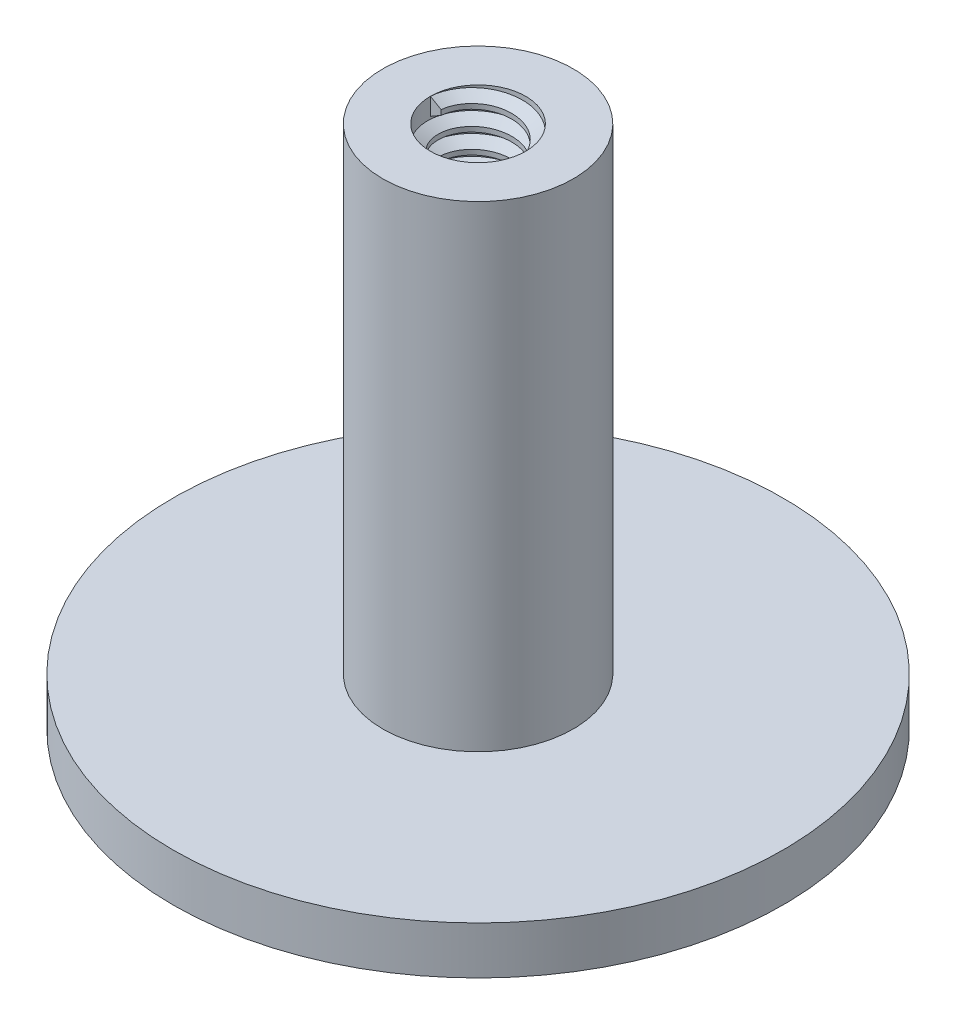
from build123d import *
from build123d.topology import SkipClean

# Parameters (mm, degrees)
SKETCH1_R           = 16.256
BOSS_EXTRUDE2_DEPTH = 2.54
SKETCH3_R           = 5.08
BOSS_EXTRUDE4_DEPTH = 25.4
SKETCH4_R           = 2.54
CUT_EXTRUDE1_DEPTH  = 24.13
THREAD1_PITCH       = 1.058333333


with BuildPart() as part:
    # Sketch1 → Boss-Extrude2 (new body)
    with BuildSketch(Plane(origin=(0, 0, 0), x_dir=(1, 0, 0), z_dir=(0, 1, 0))):
        with Locations(Location((0, 0, 0), (0, 0, 270))):
            Circle(SKETCH1_R)
    extrude(amount=BOSS_EXTRUDE2_DEPTH)

    # Sketch3 → Boss-Extrude4 (add)
    with BuildSketch(Plane(origin=(0, 2.54, 0), x_dir=(1, 0, 0), z_dir=(0, 1, 0))):
        with Locations(Location((0, 0, 0), (0, 0, 270))):
            Circle(SKETCH3_R)
    extrude(amount=BOSS_EXTRUDE4_DEPTH)

    # Sketch4 → Cut-Extrude1 (cut)
    with BuildSketch(Plane(origin=(0, 27.94, 0), x_dir=(1, 0, 0), z_dir=(0, 1, 0))):
        with Locations(Location((0, 0, 0), (0, 0, 270))):
            Circle(SKETCH4_R)
    extrude(amount=-CUT_EXTRUDE1_DEPTH, mode=Mode.SUBTRACT)

    # Thread1: the profile of Thread Profile1 profile screwed along a right-hand helix of 19.2 turns, 8 arcs to a turn; built about Z, then put on its axis
    with SkipClean():  # the faces are left unmerged after this step: merging them gives an invalid solid
        thread1_z = Axis((0, 0, 0), (0, 0, 1))
        thread1_corners = [(2.5403, 0, -0.000173205), (2.5403, 0, 0.926214869), (1.967160282, 0, 0.595312499), (1.967160282, 0, 0.330729165)]
        with BuildLine(mode=Mode.PRIVATE) as thread1_profile:
            Line(thread1_corners[0], thread1_corners[1])
            Line(thread1_corners[1], thread1_corners[2])
            Line(thread1_corners[2], thread1_corners[3])
            Line(thread1_corners[3], thread1_corners[0])
        thread1_cap = Face(thread1_profile.wire())
        thread1_turn_angles = [0, 22.5, 45, 67.5, 90, 112.5, 135, 157.5, 180, 202.5, 225, 247.5, 270, 292.5, 315, 337.5, 360]
        thread1_turn_weights = [1, 0.9238795325112867, 1, 0.9238795325112867, 1, 0.9238795325112867, 1, 0.9238795325112867, 1, 0.9238795325112867, 1, 0.9238795325112867, 1, 0.9238795325112867, 1, 0.9238795325112867, 1]
        thread1_turn_rails = [Edge.make_bspline([Vector(p[0], p[1], 0).rotate(thread1_z, thread1_turn_angles[k]) / thread1_turn_weights[k] + Vector(0, 0, p[2] + THREAD1_PITCH * thread1_turn_angles[k] / 360) for k in range(17)], [0, 0, 0, 1, 1, 2, 2, 3, 3, 4, 4, 5, 5, 6, 6, 7, 7, 8, 8, 8], 2, thread1_turn_weights) for p in thread1_corners]
        thread1_turn_sides = [Face.make_surface_from_curves(thread1_turn_rails[p[0]], thread1_turn_rails[p[1]]) for p in [(0, 1), (1, 2), (2, 3), (3, 0)]]
        thread1_last_angles = [6840, 6862.5, 6885, 6898.5, 6912]
        thread1_last_weights = [1, 0.9238795325112867, 1, 0.9723699203976748, 1]
        thread1_last_rails = [Edge.make_bspline([Vector(p[0], p[1], 0).rotate(thread1_z, thread1_last_angles[k]) / thread1_last_weights[k] + Vector(0, 0, p[2] + THREAD1_PITCH * thread1_last_angles[k] / 360) for k in range(5)], [0, 0, 0, 1, 1, 2, 2, 2], 2, thread1_last_weights) for p in thread1_corners]
        thread1_last_sides = [Face.make_surface_from_curves(thread1_last_rails[p[0]], thread1_last_rails[p[1]]) for p in [(0, 1), (1, 2), (2, 3), (3, 0)]]
        thread1 = Plane(origin=(0, 27.94, 0), x_dir=(-1, 0, 0), z_dir=(0, -1, 0)) * Solid(Shell([*[p.moved(Location((0, 0, THREAD1_PITCH * i))) for i in range(19) for p in thread1_turn_sides], *thread1_last_sides, thread1_cap, thread1_cap.rotate(thread1_z, 6912).moved(Location((0, 0, THREAD1_PITCH * 6912 / 360)))]))
        add(thread1)


solid = part.part
